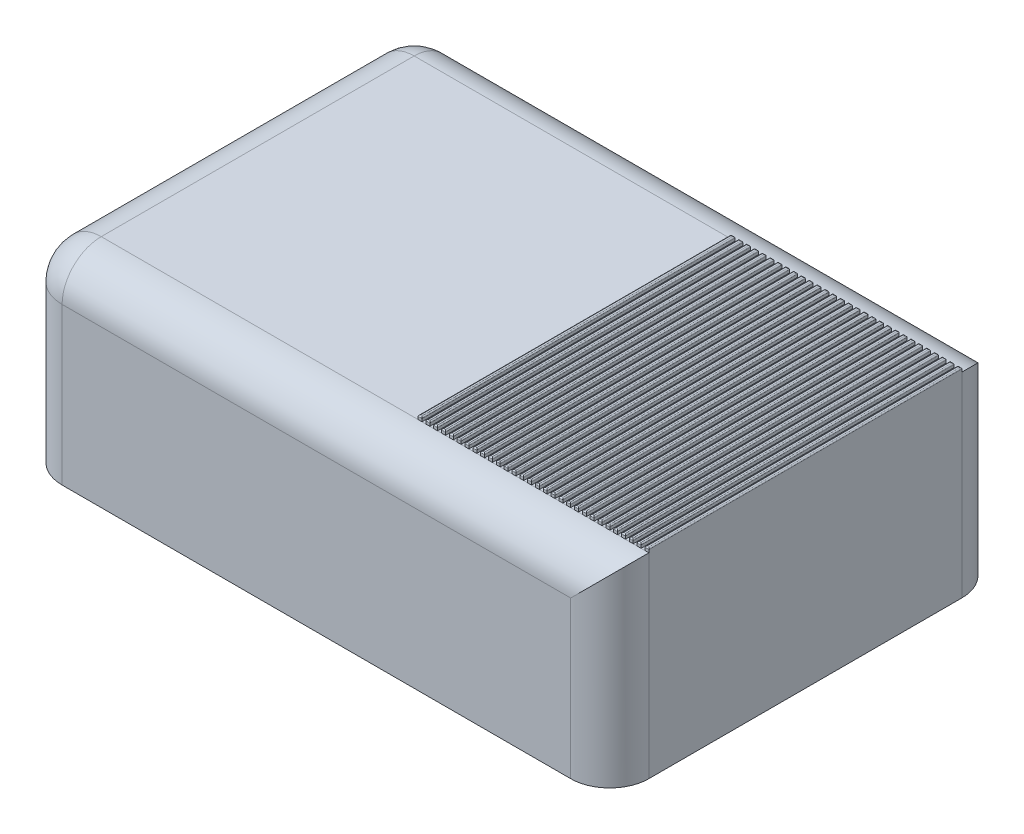
from build123d import *

# Parameters (mm, degrees)
SKETCH3_W           = 75
SKETCH3_H           = 50
BOSS_EXTRUDE1_DEPTH = 25
SKETCH4_W           = 10
SKETCH4_H           = 20
BOSS_EXTRUDE2_DEPTH = 15
FILLET1_R           = 5
SKETCH5_R           = 2.5
CUT_EXTRUDE1_DEPTH  = 58.063561053
SKETCH8_R           = 2.75
CUT_EXTRUDE2_DEPTH  = 5
SKETCH9_R           = 2.125
BOSS_EXTRUDE3_DEPTH = 10
BOSS_EXTRUDE4_START = 0.75
BOSS_EXTRUDE4_DEPTH = 0.75
FILLET2_R           = 5
SKETCH13_W          = 0.5
SKETCH13_H          = 40
BOSS_EXTRUDE5_DEPTH = 0.5
FILLET3_R           = 0.15
SKETCH14_W          = 5
SKETCH14_H          = 15
BOSS_EXTRUDE6_DEPTH = 8
FILLET4_R           = 2
SKETCH15_R          = 4
CUT_EXTRUDE3_DEPTH  = 10
FILLET5_R           = 2


# Some blends are built 0.0001 mm under size
with BuildPart() as part:
    # Sketch3 → Boss-Extrude1 (new body)
    with BuildSketch(Plane(origin=(0, 0, 0), x_dir=(1, 0, 0), z_dir=(0, 1, 0))):
        Rectangle(SKETCH3_W, SKETCH3_H)
    extrude(amount=BOSS_EXTRUDE1_DEPTH)

    # Sketch4 → Boss-Extrude2 (add)
    with BuildSketch(Plane.XZ):
        with Locations((12.5, 0)):
            Rectangle(SKETCH4_W, SKETCH4_H)
    extrude(amount=BOSS_EXTRUDE2_DEPTH)

    # Fillet1
    fillet1_edges = [part.edges().sort_by_distance(p)[0] for p in [
        (7.5, -15, 0),
        (17.5, -15, 0),
    ]]
    fillet(fillet1_edges, radius=FILLET1_R - 0.0001)  # a hair under: the kernel refuses the full size

    # Sketch5 → Cut-Extrude1 (cut, through all)
    with BuildSketch(Plane.XY.offset(10)):
        with Locations((12.5, -10)):
            Circle(SKETCH5_R)
    extrude(amount=-CUT_EXTRUDE1_DEPTH, mode=Mode.SUBTRACT)

    # Sketch8 → Cut-Extrude2 (cut)
    with BuildSketch(Plane(origin=(0, 0, 0), x_dir=(-1, 0, 0), z_dir=(0, -1, 0))):
        with Locations(Location((-27.5, 0, 0), (0, 0, 90))):
            Circle(SKETCH8_R)
    extrude(amount=-CUT_EXTRUDE2_DEPTH, mode=Mode.SUBTRACT)

    # Sketch9 → Boss-Extrude3 (add)
    with BuildSketch(Plane.XZ.offset(-5)):
        with Locations(Location((27.5, 0, 0), (0, 0, 270))):
            Circle(SKETCH9_R)
    extrude(amount=BOSS_EXTRUDE3_DEPTH)

    # Sketch10 → Boss-Extrude4 (add)
    with BuildSketch(Plane(origin=(0, 2, 0), x_dir=(-1, 0, 0), z_dir=(0, -1, 0)).offset(BOSS_EXTRUDE4_START)):
        with BuildLine():
            ThreePointArc((-28.625, -1.948557159), (-29.448557159, -1.125), (-29.75, 0))
            Line((-29.75, 0), (-30.25, 0))
            ThreePointArc((-30.25, 0), (-29.88156986, -1.375), (-28.875, -2.38156986))
            Line((-28.875, -2.38156986), (-28.625, -1.948557159))
        make_face()
        with BuildLine():
            ThreePointArc((-26.375, 1.948557159), (-25.551442841, 1.125), (-25.25, 0))
            Line((-25.25, 0), (-24.75, 0))
            ThreePointArc((-24.75, 0), (-25.11843014, 1.375), (-26.125, 2.38156986))
            Line((-26.125, 2.38156986), (-26.375, 1.948557159))
        make_face()
    extrude(amount=-BOSS_EXTRUDE4_DEPTH)

    # Fillet2
    fillet2_edges = [part.edges().sort_by_distance(p)[0] for p in [
        (-37.5, 25, 0),
        (0, 25, 25),
        (37.5, 12.5, 25),
        (-37.5, 12.5, 25),
        (-37.5, 12.5, -25),
        (37.5, 12.5, -25),
        (0, 25, -25),
    ]]
    fillet(fillet2_edges, radius=FILLET2_R)

    # Sketch13 → Boss-Extrude5 (add)
    with BuildSketch(Plane(origin=(0, 25, 0), x_dir=(1, 0, 0), z_dir=(0, 1, 0))):
        with Locations((37.25, 0)):
            Rectangle(SKETCH13_W, SKETCH13_H)
        with Locations((36.25, 0)):
            Rectangle(SKETCH13_W, SKETCH13_H)
        with Locations((35.25, 0)):
            Rectangle(SKETCH13_W, SKETCH13_H)
        with Locations((34.25, 0)):
            Rectangle(SKETCH13_W, SKETCH13_H)
        with Locations((33.25, 0)):
            Rectangle(SKETCH13_W, SKETCH13_H)
        with Locations((32.25, 0)):
            Rectangle(SKETCH13_W, SKETCH13_H)
        with Locations((31.25, 0)):
            Rectangle(SKETCH13_W, SKETCH13_H)
        with Locations((30.25, 0)):
            Rectangle(SKETCH13_W, SKETCH13_H)
        with Locations((29.25, 0)):
            Rectangle(SKETCH13_W, SKETCH13_H)
        with Locations((28.25, 0)):
            Rectangle(SKETCH13_W, SKETCH13_H)
        with Locations((27.25, 0)):
            Rectangle(SKETCH13_W, SKETCH13_H)
        with Locations((26.25, 0)):
            Rectangle(SKETCH13_W, SKETCH13_H)
        with Locations((25.25, 0)):
            Rectangle(SKETCH13_W, SKETCH13_H)
        with Locations((24.25, 0)):
            Rectangle(SKETCH13_W, SKETCH13_H)
        with Locations((23.25, 0)):
            Rectangle(SKETCH13_W, SKETCH13_H)
        with Locations((22.25, 0)):
            Rectangle(SKETCH13_W, SKETCH13_H)
        with Locations((21.25, 0)):
            Rectangle(SKETCH13_W, SKETCH13_H)
        with Locations((20.25, 0)):
            Rectangle(SKETCH13_W, SKETCH13_H)
        with Locations((19.25, 0)):
            Rectangle(SKETCH13_W, SKETCH13_H)
        with Locations((18.25, 0)):
            Rectangle(SKETCH13_W, SKETCH13_H)
        with Locations((17.25, 0)):
            Rectangle(SKETCH13_W, SKETCH13_H)
        with Locations((16.25, 0)):
            Rectangle(SKETCH13_W, SKETCH13_H)
        with Locations((15.25, 0)):
            Rectangle(SKETCH13_W, SKETCH13_H)
        with Locations((14.25, 0)):
            Rectangle(SKETCH13_W, SKETCH13_H)
        with Locations((13.25, 0)):
            Rectangle(SKETCH13_W, SKETCH13_H)
        with Locations((12.25, 0)):
            Rectangle(SKETCH13_W, SKETCH13_H)
        with Locations((11.25, 0)):
            Rectangle(SKETCH13_W, SKETCH13_H)
        with Locations((10.25, 0)):
            Rectangle(SKETCH13_W, SKETCH13_H)
        with Locations((9.25, 0)):
            Rectangle(SKETCH13_W, SKETCH13_H)
        with Locations((8.25, 0)):
            Rectangle(SKETCH13_W, SKETCH13_H)
    extrude(amount=BOSS_EXTRUDE5_DEPTH)

    # Fillet3
    fillet3_edges = [part.edges().sort_by_distance(p)[0] for p in [
        (37.5, 25.5, 0),
        (37.25, 25.5, -20),
        (37, 25.5, 0),
        (37.25, 25.5, 20),
        (36.25, 25.5, 20),
        (36.5, 25.5, 0),
        (36.25, 25.5, -20),
        (36, 25.5, 0),
        (35.25, 25.5, 20),
        (35.5, 25.5, 0),
        (35.25, 25.5, -20),
        (35, 25.5, 0),
        (34.25, 25.5, 20),
        (34.5, 25.5, 0),
        (34.25, 25.5, -20),
        (34, 25.5, 0),
        (33.25, 25.5, 20),
        (33.5, 25.5, 0),
        (33.25, 25.5, -20),
        (33, 25.5, 0),
        (32.25, 25.5, 20),
        (32.5, 25.5, 0),
        (32.25, 25.5, -20),
        (32, 25.5, 0),
        (31.25, 25.5, 20),
        (31.5, 25.5, 0),
        (31.25, 25.5, -20),
        (31, 25.5, 0),
        (30.25, 25.5, 20),
        (30.5, 25.5, 0),
        (30.25, 25.5, -20),
        (30, 25.5, 0),
        (29.25, 25.5, 20),
        (29.5, 25.5, 0),
        (29.25, 25.5, -20),
        (29, 25.5, 0),
        (28.25, 25.5, 20),
        (28.5, 25.5, 0),
        (28.25, 25.5, -20),
        (28, 25.5, 0),
        (27.25, 25.5, 20),
        (27.5, 25.5, 0),
        (27.25, 25.5, -20),
        (27, 25.5, 0),
        (26.25, 25.5, 20),
        (26.5, 25.5, 0),
        (26.25, 25.5, -20),
        (26, 25.5, 0),
        (25.25, 25.5, 20),
        (25.5, 25.5, 0),
        (25.25, 25.5, -20),
        (25, 25.5, 0),
        (24.25, 25.5, 20),
        (24.5, 25.5, 0),
        (24.25, 25.5, -20),
        (24, 25.5, 0),
        (23.25, 25.5, 20),
        (23.5, 25.5, 0),
        (23.25, 25.5, -20),
        (23, 25.5, 0),
        (22.25, 25.5, 20),
        (22.5, 25.5, 0),
        (22.25, 25.5, -20),
        (22, 25.5, 0),
        (21.25, 25.5, 20),
        (21.5, 25.5, 0),
        (21.25, 25.5, -20),
        (21, 25.5, 0),
        (20.25, 25.5, 20),
        (20.5, 25.5, 0),
        (20.25, 25.5, -20),
        (20, 25.5, 0),
        (19.25, 25.5, 20),
        (19.5, 25.5, 0),
        (19.25, 25.5, -20),
        (19, 25.5, 0),
        (18.25, 25.5, 20),
        (18.5, 25.5, 0),
        (18.25, 25.5, -20),
        (18, 25.5, 0),
        (17.25, 25.5, 20),
        (17.5, 25.5, 0),
        (17.25, 25.5, -20),
        (17, 25.5, 0),
        (16.25, 25.5, 20),
        (16.5, 25.5, 0),
        (16.25, 25.5, -20),
        (16, 25.5, 0),
        (15.25, 25.5, 20),
        (15.5, 25.5, 0),
        (15.25, 25.5, -20),
        (15, 25.5, 0),
        (14.25, 25.5, 20),
        (14.5, 25.5, 0),
        (14.25, 25.5, -20),
        (14, 25.5, 0),
        (13.25, 25.5, 20),
        (13.5, 25.5, 0),
        (13.25, 25.5, -20),
        (13, 25.5, 0),
        (12.25, 25.5, 20),
        (12.5, 25.5, 0),
        (12.25, 25.5, -20),
        (12, 25.5, 0),
        (11.25, 25.5, 20),
        (11.5, 25.5, 0),
        (11.25, 25.5, -20),
        (11, 25.5, 0),
        (10.25, 25.5, 20),
        (10.5, 25.5, 0),
        (10.25, 25.5, -20),
        (10, 25.5, 0),
        (9.25, 25.5, 20),
        (9.5, 25.5, 0),
        (9.25, 25.5, -20),
        (9, 25.5, 0),
        (8.25, 25.5, 20),
        (8.5, 25.5, 0),
        (8.25, 25.5, -20),
        (8, 25.5, 0),
    ]]
    fillet(fillet3_edges, radius=FILLET3_R)

    # Sketch14 → Boss-Extrude6 (add)
    with BuildSketch(Plane.XZ):
        with Locations((-23, 0)):
            Rectangle(SKETCH14_W, SKETCH14_H)
    extrude(amount=BOSS_EXTRUDE6_DEPTH)

    # Fillet4
    fillet4_edges = [part.edges().sort_by_distance(p)[0] for p in [
        (-20.5, -4, -7.5),
        (-20.5, -4, 7.5),
        (-25.5, -4, 7.5),
        (-25.5, -4, -7.5),
        (-23, -8, 7.5),
        (-23, -8, -7.5),
    ]]
    fillet(fillet4_edges, radius=FILLET4_R)

    # Sketch15 → Cut-Extrude3 (cut)
    with BuildSketch(Plane.ZY.offset(25.5)):
        with Locations((0, -8)):
            Circle(SKETCH15_R)
    extrude(amount=-CUT_EXTRUDE3_DEPTH, mode=Mode.SUBTRACT)

    # Fillet5
    # the kernel refuses this fillet: 2 mm, written as the material it takes off along each edge
    with BuildSketch(Plane(origin=(-29.25, -8, 4), x_dir=(0, 0.9856931110091562, -0.16854996561581068), z_dir=(1, 0, 0))) as fillet5_piece_1:
        with BuildLine():
            CenterArc((1.685499656, 1.971386222), FILLET5_R, 194.265960627, 66.030517682)
            Line((-0.252824948, 1.478539667), (-0.291591441, 1.468682735))
            ThreePointArc((-0.291591441, 1.468682735), (-0.165840199, 0.732527835), (-0.039427724, -0.006741999))
            Line((-0.039427724, -0.006741999), (0.006741999, -0.039427724))
            ThreePointArc((0.006741999, -0.039427724), (0.674199862, 0.017227556), (1.341657726, -0.039427724))
            Line((1.341657726, -0.039427724), (1.348399725, 0))
        make_face()
    extrude(amount=12.5, mode=Mode.SUBTRACT)
    with BuildSketch(Plane(origin=(-16.75, -8, -4), x_dir=(0, 0, -1), z_dir=(-1, 0, 0))) as fillet5_piece_2:
        with BuildLine():
            CenterArc((1.659090909, -1.99366248), FILLET5_R, 94.562438935, 66.030517682)
            Line((-0.227272727, -1.32910832), (-0.265, -1.315817237))
            ThreePointArc((-0.265, -1.315817237), (-0.09665528, -0.667457864), (-0.04, 0))
            Line((-0.04, 0), (0, 0.04))
            ThreePointArc((0, 0.04), (0.75, 0.04), (1.496818182, 0.03987325))
            Line((1.496818182, 0.03987325), (1.5, 0))
        make_face()
    extrude(amount=12.5, mode=Mode.SUBTRACT)


solid = part.part
